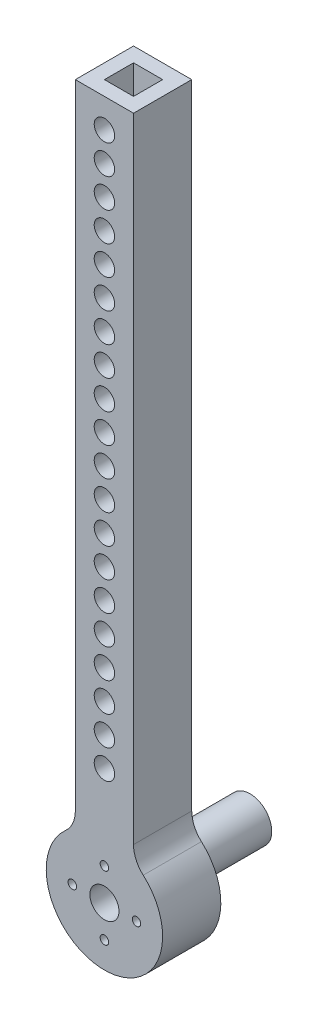
from build123d import *

# Parameters (mm, degrees)
SKETCH1_W           = 12.7
SKETCH1_H           = 12.7
SKETCH1_W_2         = 6.35
SKETCH1_H_2         = 6.35
BOSS_EXTRUDE1_DEPTH = 152.4
SKETCH2_R           = 2.226999991
CUT_EXTRUDE1_DEPTH  = 154.060029074
SKETCH3_R           = 12.7
BOSS_EXTRUDE2_DEPTH = 12.7
SKETCH4_R           = 4.7625
BOSS_EXTRUDE3_DEPTH = 31.75
SKETCH6_R           = 3.175
SKETCH6_R_2         = 0.927000051
CUT_EXTRUDE3_DEPTH  = 157.189348228
FILLET2_R           = 6.35


with BuildPart() as part:
    # Sketch1 → Boss-Extrude1 (new body)
    with BuildSketch(Plane(origin=(0, 0, 0), x_dir=(1, 0, 0), z_dir=(0, 1, 0))):
        Rectangle(SKETCH1_W, SKETCH1_H)
        Rectangle(SKETCH1_W_2, SKETCH1_H_2, mode=Mode.SUBTRACT)
    extrude(amount=BOSS_EXTRUDE1_DEPTH)

    # Sketch2 → Cut-Extrude1 (cut, through all)
    with BuildSketch(Plane.XY.offset(6.35)):
        with Locations((0, 25.4)):
            Circle(SKETCH2_R)
        with Locations((0, 31.75)):
            Circle(SKETCH2_R)
        with Locations((0, 38.1)):
            Circle(SKETCH2_R)
        with Locations((0, 44.45)):
            Circle(SKETCH2_R)
        with Locations((0, 50.8)):
            Circle(SKETCH2_R)
        with Locations((0, 57.15)):
            Circle(SKETCH2_R)
        with Locations((0, 63.5)):
            Circle(SKETCH2_R)
        with Locations((0, 69.85)):
            Circle(SKETCH2_R)
        with Locations((0, 76.2)):
            Circle(SKETCH2_R)
        with Locations((0, 82.55)):
            Circle(SKETCH2_R)
        with Locations((0, 88.9)):
            Circle(SKETCH2_R)
        with Locations((0, 95.25)):
            Circle(SKETCH2_R)
        with Locations((0, 101.6)):
            Circle(SKETCH2_R)
        with Locations((0, 107.95)):
            Circle(SKETCH2_R)
        with Locations((0, 114.3)):
            Circle(SKETCH2_R)
        with Locations((0, 120.65)):
            Circle(SKETCH2_R)
        with Locations((0, 127)):
            Circle(SKETCH2_R)
        with Locations((0, 133.35)):
            Circle(SKETCH2_R)
        with Locations((0, 139.7)):
            Circle(SKETCH2_R)
        with Locations((0, 146.05)):
            Circle(SKETCH2_R)
    extrude(amount=-CUT_EXTRUDE1_DEPTH, mode=Mode.SUBTRACT)

    # Sketch3 → Boss-Extrude2 (add)
    with BuildSketch(Plane.XY.offset(6.35)):
        Circle(SKETCH3_R)
    extrude(amount=-BOSS_EXTRUDE2_DEPTH)

    # Sketch4 → Boss-Extrude3 (add)
    with BuildSketch(Plane.XY.offset(6.35)):
        Circle(SKETCH4_R)
    extrude(amount=-BOSS_EXTRUDE3_DEPTH)

    # Sketch6 → Cut-Extrude3 (cut, through all)
    with BuildSketch(Plane.XY.offset(6.35)):
        Circle(SKETCH6_R)
        with Locations((6.99999997, 0)):
            Circle(SKETCH6_R_2)
        with Locations((0, -6.99999997)):
            Circle(SKETCH6_R_2)
        with Locations((-6.99999997, 0)):
            Circle(SKETCH6_R_2)
        with Locations((0, 6.99999997)):
            Circle(SKETCH6_R_2)
    extrude(amount=-CUT_EXTRUDE3_DEPTH, mode=Mode.SUBTRACT)

    # Fillet2
    fillet2_edges = [part.edges().sort_by_distance(p)[0] for p in [
        (-6.35, 10.998522628, 0),
        (6.35, 10.998522628, 0),
    ]]
    fillet(fillet2_edges, radius=FILLET2_R)


solid = part.part
